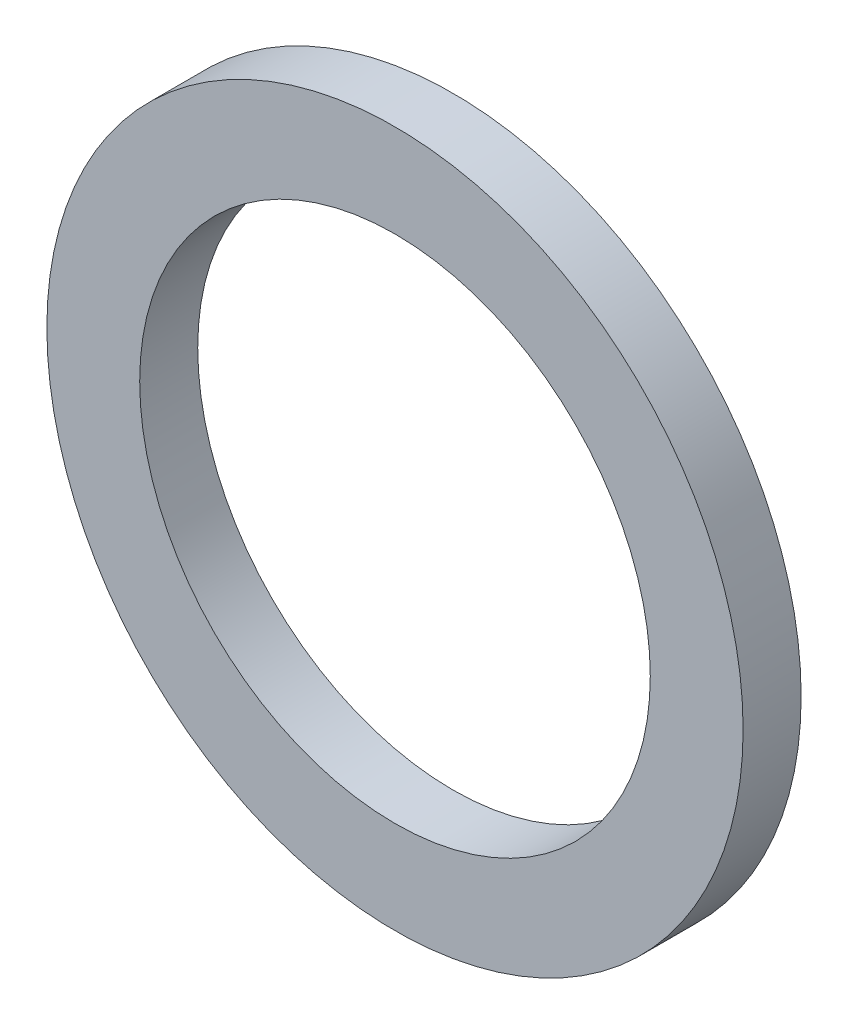
from build123d import *

# Parameters (mm, degrees)
SKETCH1_R               = 30
SKETCH1_R_2             = 22
SPRING_OUTER_RING_DEPTH = 2.5


with BuildPart() as part:
    # Sketch1 → Spring Outer Ring (new, symmetric)
    with BuildSketch(Plane.XY):
        Circle(SKETCH1_R)
        Circle(SKETCH1_R_2, mode=Mode.SUBTRACT)
    extrude(amount=SPRING_OUTER_RING_DEPTH, both=True)


solid = part.part
